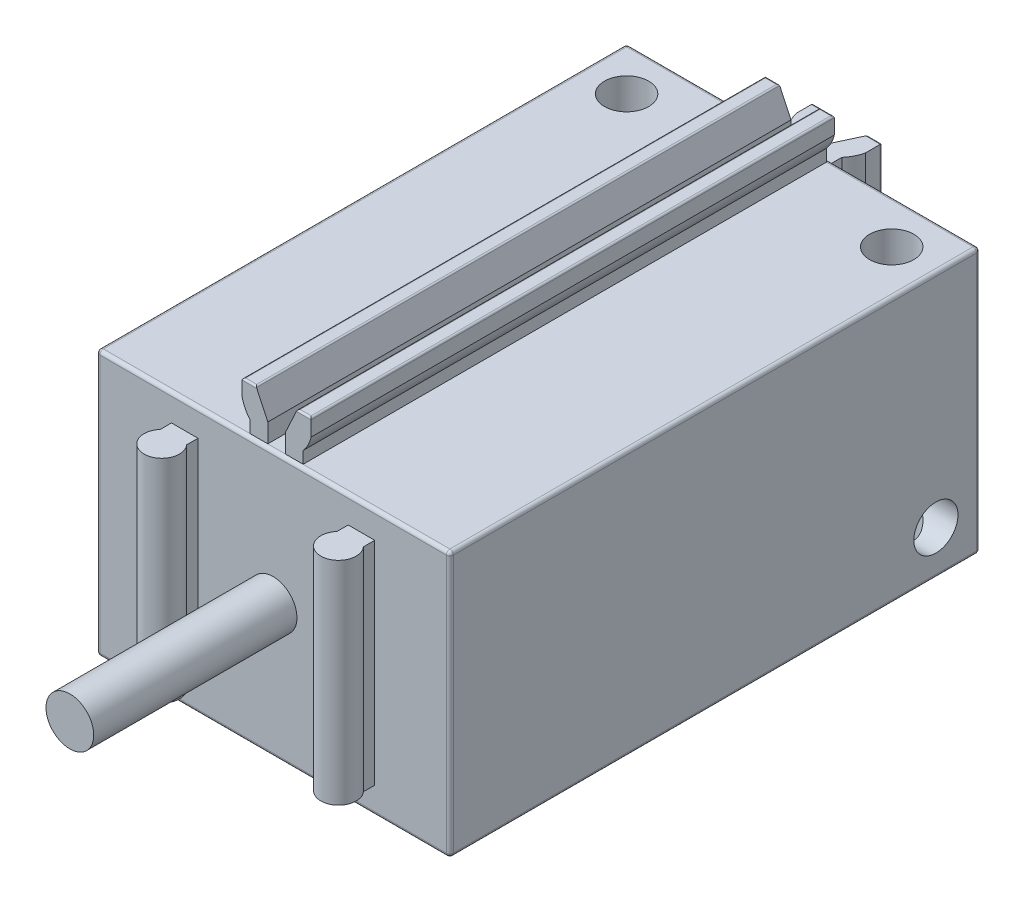
from build123d import *

# Parameters (mm, degrees)
SKETCH_1_W           = 20
SKETCH_1_H           = 15
EXTRUDE_1_DEPTH      = 30
EXTRUDE_2_DEPTH      = 6
EXTRUDE_2_DEPTH_BACK = 6
SKETCH_3_R           = 1.35
EXTRUDE_3_DEPTH      = 11.5
EXTRUDE_START        = -0.2
EXTRUDE_4_DEPTH      = 29.6
EXTRUDE_5_DEPTH      = 14.6
FILLET_1_R           = 0.1
FILLET_2_R           = 0.2
SKETCH_6_R           = 1.25
CUT_EXTRUDE_1_DEPTH  = 38.165171868
SKETCH_7_R           = 1.25
CUT_EXTRUDE_2_DEPTH  = 40.449334595
SKETCH_8_R           = 1.25
CUT_EXTRUDE_3_DEPTH  = 5


with BuildPart() as part:
    # 草图1 → 凸台-拉伸1 (new body)
    with BuildSketch(Plane.XY):
        Rectangle(SKETCH_1_W, SKETCH_1_H)
    extrude(amount=-EXTRUDE_1_DEPTH)

    # 草图2 → 凸台-拉伸2 (add, two sides: drawn at the far end of the back side and taken through both)
    with BuildSketch(Plane(origin=(0, 0, 0), x_dir=(1, 0, 0), z_dir=(0, 1, 0)).offset(-EXTRUDE_2_DEPTH_BACK)):
        with BuildLine():
            Line((-4.25, 0), (-5.75, 0))
            Line((-5.75, 0), (-5.75, -0.638562172))
            ThreePointArc((-5.75, -0.638562172), (-5, -2.3), (-4.25, -0.638562172))
            Line((-4.25, -0.638562172), (-4.25, 0))
        make_face()
        with BuildLine():
            Line((4.25, 0), (4.25, -0.638562172))
            ThreePointArc((4.25, -0.638562172), (5, -2.3), (5.75, -0.638562172))
            Line((5.75, -0.638562172), (5.75, 0))
            Line((5.75, 0), (4.25, 0))
        make_face()
    extrude(amount=EXTRUDE_2_DEPTH + EXTRUDE_2_DEPTH_BACK)

    # 草图3 → 凸台-拉伸3 (add)
    with BuildSketch(Plane.XY):
        with Locations(Location((0, 0, 0), (0, 0, 180))):
            Circle(SKETCH_3_R)
    extrude(amount=EXTRUDE_3_DEPTH)

    # 草图4 → 凸台-拉伸4 (add)
    with BuildSketch(Plane.XY.offset(EXTRUDE_START)):
        with BuildLine():
            Line((-1.5, 7.5), (-1.5, 8.177124344))
            ThreePointArc((-1.5, 8.177124344), (-1.780042303, 8.588161527), (-1.95, 9.055590279))
            Line((-1.95, 9.055590279), (-1.95, 10))
            Line((-1.95, 10), (-1.165769145, 10))
            Line((-1.165769145, 10), (-0.5, 8.57225346))
            Line((-0.5, 8.57225346), (-0.5, 7.5))
            Line((-0.5, 7.5), (-1.5, 7.5))
        make_face()
        with BuildLine():
            Line((1.5, 7.5), (1.5, 8.177124344))
            ThreePointArc((1.5, 8.177124344), (1.780042303, 8.588161527), (1.95, 9.055590279))
            Line((1.95, 9.055590279), (1.95, 10))
            Line((1.95, 10), (1.165769145, 10))
            Line((1.165769145, 10), (0.5, 8.57225346))
            Line((0.5, 8.57225346), (0.5, 7.5))
            Line((0.5, 7.5), (1.5, 7.5))
        make_face()
    extrude(amount=-EXTRUDE_4_DEPTH)

    # 草图5 → 凸台-拉伸5 (add)
    with BuildSketch(Plane(origin=(0, 7.5, 0), x_dir=(-1, 0, 0), z_dir=(0, 1, 0)).offset(EXTRUDE_START)):
        with BuildLine():
            Line((1.5, -30), (1.5, -30.677124344))
            ThreePointArc((1.5, -30.677124344), (1.780042303, -31.088161527), (1.95, -31.555590279))
            Line((1.95, -31.555590279), (1.95, -32.5))
            Line((1.95, -32.5), (1.165769145, -32.5))
            Line((1.165769145, -32.5), (0.5, -31.07225346))
            Line((0.5, -31.07225346), (0.5, -30))
            Line((0.5, -30), (1.5, -30))
        make_face()
        with BuildLine():
            Line((-1.5, -30), (-1.5, -30.677124344))
            ThreePointArc((-1.5, -30.677124344), (-1.780042303, -31.088161527), (-1.95, -31.555590279))
            Line((-1.95, -31.555590279), (-1.95, -32.5))
            Line((-1.95, -32.5), (-1.165769145, -32.5))
            Line((-1.165769145, -32.5), (-0.5, -31.07225346))
            Line((-0.5, -31.07225346), (-0.5, -30))
            Line((-0.5, -30), (-1.5, -30))
        make_face()
    extrude(amount=-EXTRUDE_5_DEPTH)

    # 圆角1
    fillet_1_edges = [part.edges().sort_by_distance(p)[0] for p in [
        (-1.557884573, -7.3, -32.5),
        (-1.95, 0, -32.5),
        (-1.165769145, 0, -32.5),
        (-1.557884573, 7.3, -32.5),
        (-1.557884573, 10, -29.8),
        (-1.95, 10, -15),
        (-1.165769145, 10, -15),
        (-1.557884573, 10, -0.2),
        (1.557884573, 10, -29.8),
        (1.165769145, 10, -15),
        (1.95, 10, -15),
        (1.557884573, 10, -0.2),
        (1.557884573, -7.3, -32.5),
        (1.165769145, 0, -32.5),
        (1.95, 0, -32.5),
        (1.557884573, 7.3, -32.5),
    ]]
    fillet(fillet_1_edges, radius=FILLET_1_R)

    # 圆角2
    fillet_2_edges = [part.edges().sort_by_distance(p)[0] for p in [
        (10, 0, -30),
        (0, 7.5, -30),
        (-10, 0, -30),
        (0, 7.5, 0),
        (10, 0, 0),
        (0, -7.5, 0),
        (-10, 0, 0),
        (0, -7.5, -30),
        (-10, 7.5, -15),
        (10, 7.5, -15),
        (10, -7.5, -15),
        (-10, -7.5, -15),
    ]]
    fillet(fillet_2_edges, radius=FILLET_2_R - 0.0001)  # a hair under: the kernel refuses the full size

    # 草图6 → 切除-拉伸1 (cut, through all)
    with BuildSketch(Plane(origin=(0, 7.5, 0), x_dir=(-1, 0, 0), z_dir=(0, 1, 0))):
        with Locations(Location((7.5, -27.5, 0), (0, 0, 90))):
            Circle(SKETCH_6_R)
        with Locations(Location((-7.5, -27.5, 0), (0, 0, 90))):
            Circle(SKETCH_6_R)
    extrude(amount=-CUT_EXTRUDE_1_DEPTH, mode=Mode.SUBTRACT)

    # 草图7 → 切除-拉伸2 (cut, through all)
    with BuildSketch(Plane.ZY.offset(10)):
        with Locations((-27.5, -5)):
            Circle(SKETCH_7_R)
    extrude(amount=-CUT_EXTRUDE_2_DEPTH, mode=Mode.SUBTRACT)

    # 草图8 → 切除-拉伸3 (cut)
    with BuildSketch(Plane(origin=(0, 0, -30), x_dir=(-1, 0, 0), z_dir=(0, 0, -1))):
        with Locations((-7.5, 0)):
            Circle(SKETCH_8_R)
        with Locations((7.5, 0)):
            Circle(SKETCH_8_R)
    extrude(amount=-CUT_EXTRUDE_3_DEPTH, mode=Mode.SUBTRACT)


solid = part.part
